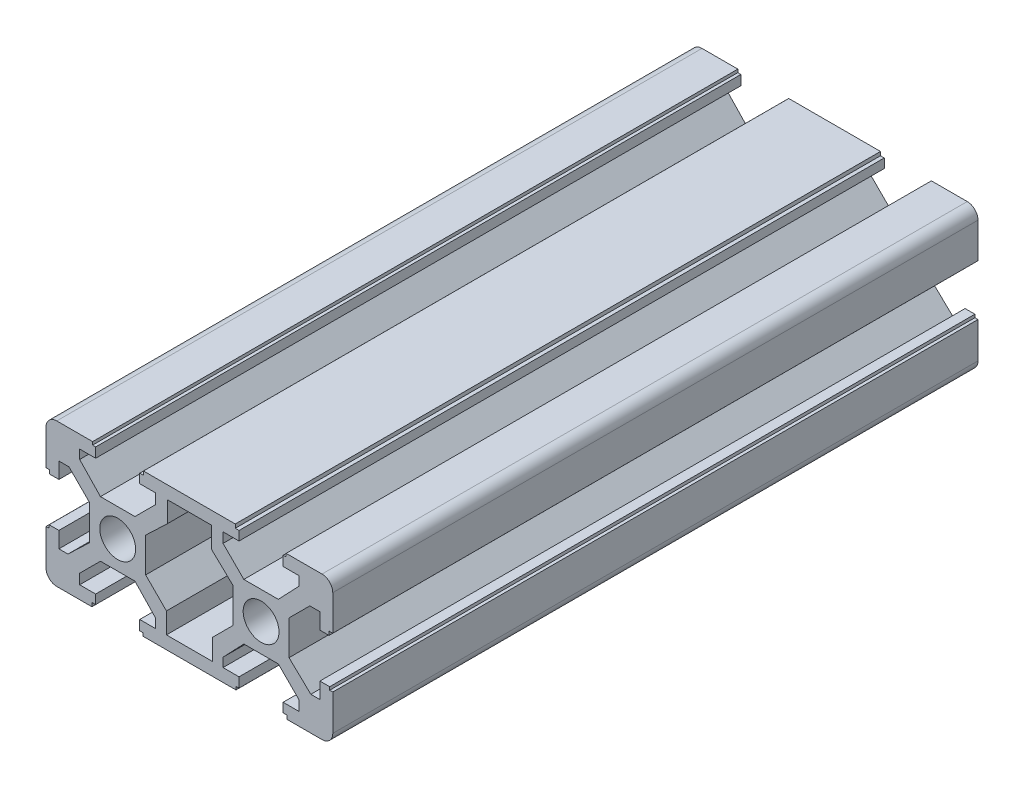
from build123d import *

# Parameters (mm, degrees)
SKETCH1_R           = 2.5
BOSS_EXTRUDE1_DEPTH = 90
FILLET1_R           = 1.5


with BuildPart() as part:
    # Sketch1 → Boss-Extrude1 (new body)
    with BuildSketch(Plane.XY):
        Polygon((-1.499992211, 10), (2.38e-06, 10), (1.500001785, 10), (6.400001785, 10), (6.400001785, 9.479132912), (6.925001785, 9.479132912), (6.925001785, 8.2), (4.695347664, 8.2), (4.695347664, 6.8), (7.595347664, 3.9), (12.404655907, 3.9), (15.304655907, 6.94037733), (15.304655907, 8.199999348), (13.075001785, 8.199999348), (13.075001785, 9.565762703), (13.497472172, 9.573136951), (13.497472172, 9.999999348), (18.397472172, 9.999999348), (20.000001785, 10), (20.000001785, 8.503508491), (20.000001785, 8.500000005), (20.000001785, 3.600001911), (19.479137611, 3.600002038), (19.479137484, 3.075002038), (18.200004571, 3.075002348), (18.200005113, 5.30465647), (16.800005113, 5.30465681), (13.900004408, 2.404657514), (13.900003241, -2.404650729), (16.940379867, -5.304651467), (18.200002536, -5.304651773), (18.200003078, -3.074997652), (19.565766433, -3.074997983), (19.573140578, -3.497468372), (20.000002975, -3.497468476), (20.000001785, -8.397468476), (20.000001785, -10), (18.500003987, -10), (13.600003987, -9.99999881), (13.600004114, -9.479131722), (13.075004114, -9.479131595), (13.075004424, -8.199998683), (15.304655907, -8.199999224), (15.304655907, -6.8), (12.404655907, -3.9), (7.595347664, -3.9), (4.695347664, -6.94037733), (4.695347664, -8.2), (6.925001785, -8.2), (6.925001785, -9.565763355), (6.502531399, -9.573137603), (6.502531399, -10), (1.602531399, -10), (2.38e-06, -10), (-1.602527233, -10), (-6.502525798, -10), (-6.502525798, -9.573137078), (-6.92499762, -9.565763355), (-6.92499762, -8.2), (-4.695343498, -8.2), (-4.695343498, -6.94037733), (-7.595343498, -3.9), (-12.404651741, -3.9), (-15.304651741, -6.8), (-15.304651741, -8.2), (-13.07499762, -8.2), (-13.07499762, -9.479132912), (-13.600001017, -9.479132912), (-13.600001017, -10), (-18.49999954, -10), (-19.99999762, -10), (-19.99999762, -3.497471822), (-19.573134698, -3.497471822), (-19.565760974, -3.075), (-18.19999762, -3.075), (-18.19999762, -5.304654122), (-16.94037495, -5.304654122), (-13.89999762, -2.404654122), (-13.89999762, 2.404654122), (-16.79999762, 5.304654122), (-18.19999762, 5.304654122), (-18.19999762, 3.075), (-19.479130532, 3.075), (-19.479130532, 3.600003398), (-19.99999762, 3.600003398), (-19.99999762, 10), (-13.497469442, 10), (-13.497469442, 9.573137078), (-13.07499762, 9.565763355), (-13.07499762, 8.2), (-15.304651741, 8.2), (-15.304651741, 6.94037733), (-12.404651741, 3.9), (-7.595343498, 3.9), (-4.695343498, 6.8), (-4.695343498, 8.2), (-6.92499762, 8.2), (-6.92499762, 9.479132912), (-6.399994222, 9.479132912), (-6.399994222, 10), align=None)
        with Locations((-9.99999762, 0)):
            Circle(SKETCH1_R, mode=Mode.SUBTRACT)
        with Locations((9.99999762, 0)):
            Circle(SKETCH1_R, mode=Mode.SUBTRACT)
        Polygon((-3.059620289, 5.304654122), (-3.059620289, 8.2), (2.38e-06, 8.2), (3.059624455, 8.2), (3.059624455, 5.304654122), (6.100001785, 2.404654122), (6.100001785, -2.404654122), (3.200001785, -5.304654122), (3.200001785, -8.2), (2.38e-06, -8.2), (-3.19999762, -8.2), (-3.19999762, -5.304654122), (-6.09999762, -2.404654122), (-6.09999762, 2.404654122), align=None, mode=Mode.SUBTRACT)
    extrude(amount=-BOSS_EXTRUDE1_DEPTH)

    # Fillet1
    fillet1_edges = [part.edges().sort_by_distance(p)[0] for p in [
        (20.000001785, 10, -45),
        (20.000001785, -10, -45),
        (-19.99999762, -10, -45),
        (-19.99999762, 10, -45),
    ]]
    fillet(fillet1_edges, radius=FILLET1_R - 0.0001)  # a hair under: the kernel refuses the full size


solid = part.part
